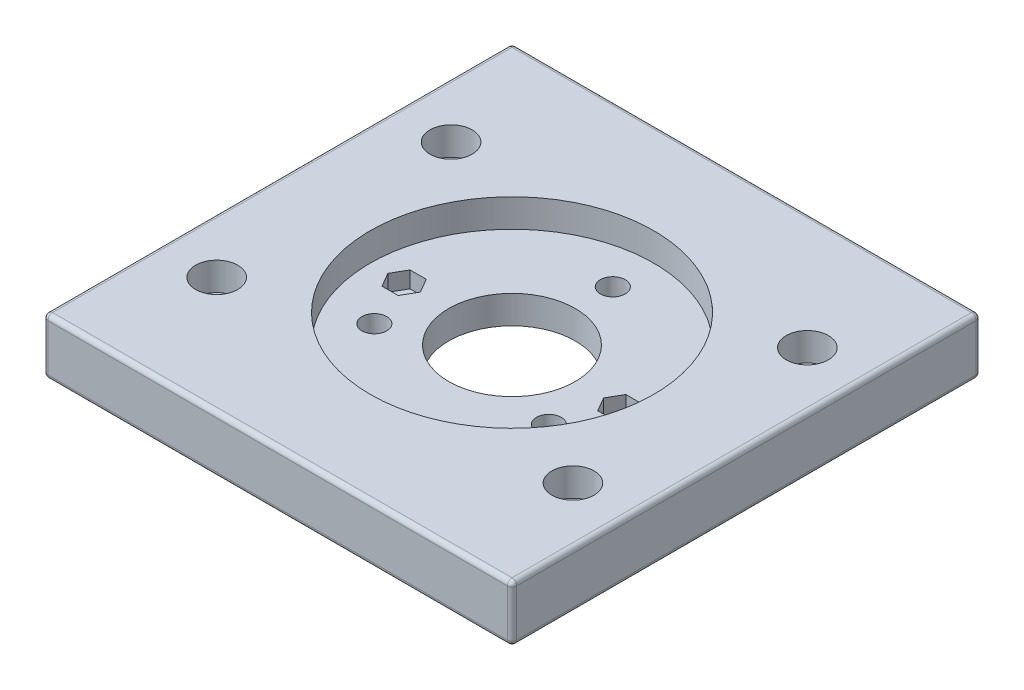
from build123d import *

# Parameters (mm, degrees)
SKETCH1_W           = 100
SKETCH1_H           = 100
SKETCH1_R           = 13.5
SKETCH1_R_2         = 2.65
SKETCH1_R_3         = 1.65
SKETCH1_R_4         = 1.75
BOSS_EXTRUDE1_DEPTH = 6
CUT_EXTRUDE2_DEPTH  = 3.5
SKETCH9_W           = 100
SKETCH9_H           = 100
SKETCH9_R           = 30.25
SKETCH9_R_2         = 4.5
BOSS_EXTRUDE2_DEPTH = 6
FILLET1_R           = 1


with BuildPart() as part:
    # Sketch1 → Boss-Extrude1 (new body)
    with BuildSketch(Plane(origin=(0, 0, 0), x_dir=(1, 0, 0), z_dir=(0, 1, 0))):
        Rectangle(SKETCH1_W, SKETCH1_H)
        Circle(SKETCH1_R, mode=Mode.SUBTRACT)
        with Locations((0, 21.5)):
            Circle(SKETCH1_R_2, mode=Mode.SUBTRACT)
        with Locations((23.0125, 0)):
            Circle(SKETCH1_R_3, mode=Mode.SUBTRACT)
        with Locations((-23.0125, 0)):
            Circle(SKETCH1_R_3, mode=Mode.SUBTRACT)
        with Locations((18.619546181, -10.75)):
            Circle(SKETCH1_R_2, mode=Mode.SUBTRACT)
        with Locations((-18.619546181, -10.75)):
            Circle(SKETCH1_R_2, mode=Mode.SUBTRACT)
        with Locations((-38, 25)):
            Circle(SKETCH1_R_4, mode=Mode.SUBTRACT)
        with Locations((-38, -25)):
            Circle(SKETCH1_R_4, mode=Mode.SUBTRACT)
        with Locations((38, -25)):
            Circle(SKETCH1_R_4, mode=Mode.SUBTRACT)
        with Locations((38, 25)):
            Circle(SKETCH1_R_4, mode=Mode.SUBTRACT)
    extrude(amount=BOSS_EXTRUDE1_DEPTH)

    # Sketch8 → Cut-Extrude2 (cut)
    with BuildSketch(Plane(origin=(0, 6, 0), x_dir=(1, 0, 0), z_dir=(0, 1, 0))):
        Polygon((19.548398385, 0), (21.280449192, -3), (24.744550808, -3), (26.476601615, 0), (24.744550808, 3), (21.280449192, 3), align=None)
        Polygon((-19.548398385, 0), (-21.280449192, 3), (-24.744550808, 3), (-26.476601615, 0), (-24.744550808, -3), (-21.280449192, -3), align=None)
    extrude(amount=-CUT_EXTRUDE2_DEPTH, mode=Mode.SUBTRACT)

    # Sketch9 → Boss-Extrude2 (add)
    with BuildSketch(Plane(origin=(0, 6, 0), x_dir=(1, 0, 0), z_dir=(0, 1, 0))):
        Rectangle(SKETCH9_W, SKETCH9_H)
        Circle(SKETCH9_R, mode=Mode.SUBTRACT)
        with Locations((-38, 25)):
            Circle(SKETCH9_R_2, mode=Mode.SUBTRACT)
        with Locations((-38, -25)):
            Circle(SKETCH9_R_2, mode=Mode.SUBTRACT)
        with Locations((38, -25)):
            Circle(SKETCH9_R_2, mode=Mode.SUBTRACT)
        with Locations((38, 25)):
            Circle(SKETCH9_R_2, mode=Mode.SUBTRACT)
    extrude(amount=BOSS_EXTRUDE2_DEPTH)

    # Fillet1
    fillet1_edges = [part.edges().sort_by_distance(p)[0] for p in [
        (50, 6, 50),
        (50, 12, 0),
        (50, 0, 0),
        (-50, 12, 0),
        (-50, 6, 50),
        (-50, 0, 0),
        (50, 6, -50),
        (0, 12, -50),
        (-50, 6, -50),
        (0, 0, -50),
        (0, 0, 50),
        (0, 12, 50),
    ]]
    fillet(fillet1_edges, radius=FILLET1_R)


solid = part.part
